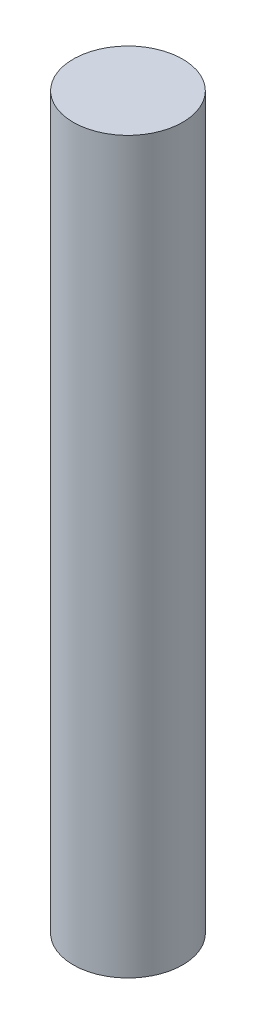
from build123d import *

# Parameters (mm, degrees)
SZKIC1_R                    = 3
DODANIE_WYCI_GNI_CIE1_DEPTH = 40


with BuildPart() as part:
    # Szkic1 → Dodanie-wyciągnięcie1 (new body)
    with BuildSketch(Plane(origin=(0, 0, 0), x_dir=(1, 0, 0), z_dir=(0, 1, 0))):
        Circle(SZKIC1_R)
    extrude(amount=DODANIE_WYCI_GNI_CIE1_DEPTH)


solid = part.part
